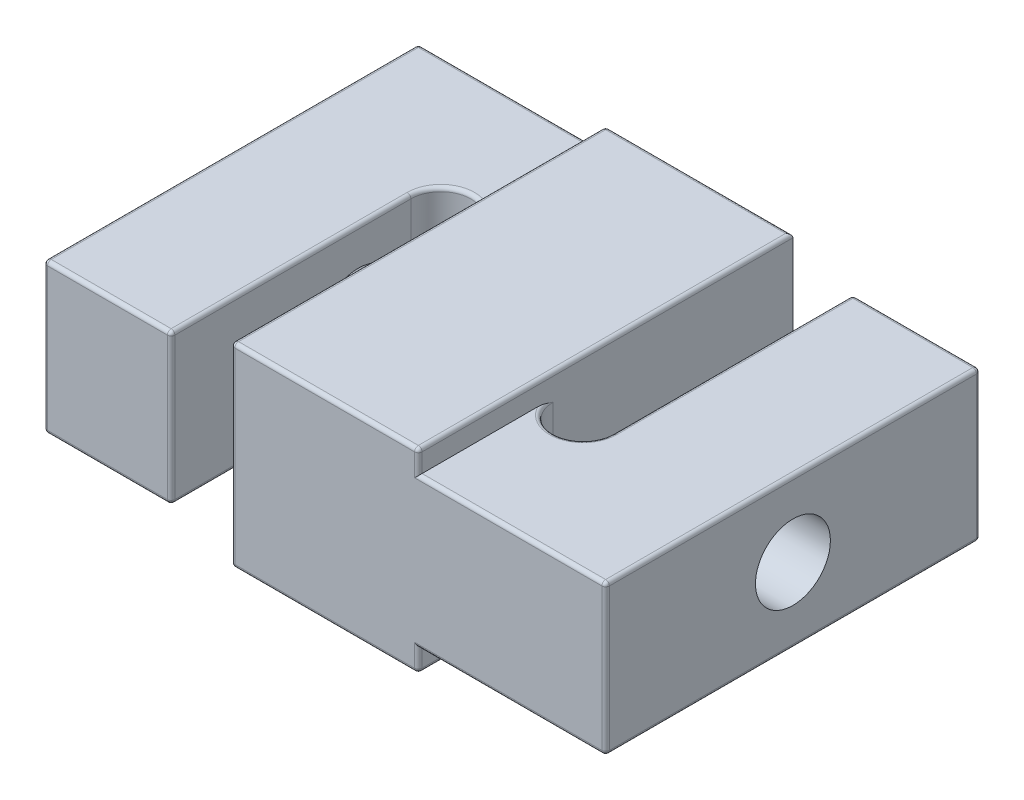
from build123d import *

# Parameters (mm, degrees)
BOSS_EXTRUDE1_DEPTH      = 10
BOSS_EXTRUDE1_DEPTH_BACK = 10
SKETCH1_W                = 75
SKETCH1_H                = 50
SKETCH2_W                = 25
SKETCH2_H                = 50
BOSS_EXTRUDE2_DEPTH      = 3
CUT_EXTRUDE1_DEPTH       = 23
SKETCH5_R                = 5
CUT_EXTRUDE2_DEPTH       = 23
CUT_EXTRUDE3_START       = -23
SKETCH4_R                = 5
CUT_EXTRUDE3_DEPTH       = 23
FILLET1_R                = 0.5


with BuildPart() as part:
    # Sketch1 → Boss-Extrude1 (new, two sides: drawn at the far end of the back side and taken through both)
    with BuildSketch(Plane(origin=(0, 0, 0), x_dir=(1, 0, 0), z_dir=(0, 1, 0)).offset(-BOSS_EXTRUDE1_DEPTH_BACK)):
        Rectangle(SKETCH1_W, SKETCH1_H)
    extrude(amount=BOSS_EXTRUDE1_DEPTH + BOSS_EXTRUDE1_DEPTH_BACK)

    # Sketch2 → Boss-Extrude2 (add)
    with BuildSketch(Plane(origin=(0, 10, 0), x_dir=(1, 0, 0), z_dir=(0, 1, 0))):
        Rectangle(SKETCH2_W, SKETCH2_H)
    boss_extrude2 = extrude(amount=BOSS_EXTRUDE2_DEPTH)

    # Mirror1: Boss-Extrude2 across plane
    add(boss_extrude2.mirror(Plane.ZX))

    # Sketch3 → Cut-Extrude1 (cut)
    with BuildSketch(Plane(origin=(0, 10, 0), x_dir=(1, 0, 0), z_dir=(0, 1, 0))):
        with BuildLine():
            Line((20.5, -7), (20.5, 25))
            Line((20.5, 25), (12.5, 25))
            Line((12.5, 25), (12.5, -7))
            ThreePointArc((12.5, -7), (16.5, -11), (20.5, -7))
        make_face()
        with BuildLine():
            Line((-20.5, 7), (-20.5, -25))
            Line((-20.5, -25), (-12.5, -25))
            Line((-12.5, -25), (-12.5, 7))
            ThreePointArc((-12.5, 7), (-16.5, 11), (-20.5, 7))
        make_face()
    extrude(amount=-CUT_EXTRUDE1_DEPTH, mode=Mode.SUBTRACT)

    # Sketch5 → Cut-Extrude2 (cut)
    with BuildSketch(Plane.ZY.offset(37.5)):
        Circle(SKETCH5_R)
    extrude(amount=-CUT_EXTRUDE2_DEPTH, mode=Mode.SUBTRACT)

    # Sketch4 → Cut-Extrude3 (cut)
    with BuildSketch(Plane(origin=(37.5, 0, 0), x_dir=(0, 0, -1), z_dir=(1, 0, 0)).offset(CUT_EXTRUDE3_START)):
        with Locations(Location((0, 0, 0), (0, 0, 180))):
            Circle(SKETCH4_R)
    extrude(amount=CUT_EXTRUDE3_DEPTH, mode=Mode.SUBTRACT)

    # Fillet1
    # the kernel refuses this fillet: 0.5 mm, written as the material it takes off along each edge
    with BuildSketch(Plane(origin=(37, -9.5, 24.5), x_dir=(0, -1, 0), z_dir=(1, 0, 0))) as fillet1_piece_1_section:
        Polygon((0, 0), (FILLET1_R, 0), (FILLET1_R, -FILLET1_R), (0, -FILLET1_R), align=None)
    fillet1_piece_1 = extrude(amount=FILLET1_R, mode=Mode.PRIVATE)
    fillet1_piece_1 = fillet1_piece_1 - Plane(origin=(37, -9.5, 24.5), x_dir=(0, 0.7071067811865475, -0.7071067811865475), z_dir=(1, 0, 0)) * Sphere(FILLET1_R, mode=Mode.PRIVATE)
    add(fillet1_piece_1, mode=Mode.SUBTRACT)
    with BuildSketch(Plane(origin=(37, 9.5, 24.5), x_dir=(0, 1, 0), z_dir=(1, 0, 0))) as fillet1_piece_2_section:
        Polygon((0, 0), (FILLET1_R, 0), (FILLET1_R, FILLET1_R), (0, FILLET1_R), align=None)
    fillet1_piece_2 = extrude(amount=FILLET1_R, mode=Mode.PRIVATE)
    fillet1_piece_2 = fillet1_piece_2 - Plane(origin=(37, 9.5, 24.5), x_dir=(0, -0.7071067811865475, -0.7071067811865475), z_dir=(1, 0, 0)) * Sphere(FILLET1_R, mode=Mode.PRIVATE)
    add(fillet1_piece_2, mode=Mode.SUBTRACT)
    with BuildSketch(Plane(origin=(37, 9.5, -24.5), x_dir=(1, 0, 0), z_dir=(0, 0, -1))) as fillet1_piece_3_section:
        Polygon((0, 0), (FILLET1_R, 0), (FILLET1_R, -FILLET1_R), (0, -FILLET1_R), align=None)
    fillet1_piece_3 = extrude(amount=FILLET1_R, mode=Mode.PRIVATE)
    fillet1_piece_3 = fillet1_piece_3 - Plane(origin=(37, 9.5, -24.5), x_dir=(-0.7071067811865475, -0.7071067811865475, 0), z_dir=(0, 0, -1)) * Sphere(FILLET1_R, mode=Mode.PRIVATE)
    add(fillet1_piece_3, mode=Mode.SUBTRACT)
    with BuildSketch(Plane(origin=(21, 9.5, -24.5), x_dir=(-1, 0, 0), z_dir=(0, 0, -1))) as fillet1_piece_4_section:
        Polygon((0, 0), (FILLET1_R, 0), (FILLET1_R, FILLET1_R), (0, FILLET1_R), align=None)
    fillet1_piece_4 = extrude(amount=FILLET1_R, mode=Mode.PRIVATE)
    fillet1_piece_4 = fillet1_piece_4 - Plane(origin=(21, 9.5, -24.5), x_dir=(0.7071067811865475, -0.7071067811865475, 0), z_dir=(0, 0, -1)) * Sphere(FILLET1_R, mode=Mode.PRIVATE)
    add(fillet1_piece_4, mode=Mode.SUBTRACT)
    with BuildSketch(Plane(origin=(-37, 9.5, -24.5), x_dir=(0, 0, -1), z_dir=(-1, 0, 0))) as fillet1_piece_5_section:
        Polygon((0, 0), (FILLET1_R, 0), (FILLET1_R, -FILLET1_R), (0, -FILLET1_R), align=None)
    fillet1_piece_5 = extrude(amount=FILLET1_R, mode=Mode.PRIVATE)
    fillet1_piece_5 = fillet1_piece_5 - Plane(origin=(-37, 9.5, -24.5), x_dir=(0, -0.7071067811865475, 0.7071067811865475), z_dir=(-1, 0, 0)) * Sphere(FILLET1_R, mode=Mode.PRIVATE)
    add(fillet1_piece_5, mode=Mode.SUBTRACT)
    with BuildSketch(Plane(origin=(-37, 9.5, 24.5), x_dir=(0, 0, 1), z_dir=(-1, 0, 0))) as fillet1_piece_6_section:
        Polygon((0, 0), (FILLET1_R, 0), (FILLET1_R, FILLET1_R), (0, FILLET1_R), align=None)
    fillet1_piece_6 = extrude(amount=FILLET1_R, mode=Mode.PRIVATE)
    fillet1_piece_6 = fillet1_piece_6 - Plane(origin=(-37, 9.5, 24.5), x_dir=(0, -0.7071067811865475, -0.7071067811865475), z_dir=(-1, 0, 0)) * Sphere(FILLET1_R, mode=Mode.PRIVATE)
    add(fillet1_piece_6, mode=Mode.SUBTRACT)
    with BuildSketch(Plane(origin=(37, -9.5, -24.5), x_dir=(1, 0, 0), z_dir=(0, 0, -1))) as fillet1_piece_7_section:
        Polygon((0, 0), (FILLET1_R, 0), (FILLET1_R, FILLET1_R), (0, FILLET1_R), align=None)
    fillet1_piece_7 = extrude(amount=FILLET1_R, mode=Mode.PRIVATE)
    fillet1_piece_7 = fillet1_piece_7 - Plane(origin=(37, -9.5, -24.5), x_dir=(-0.7071067811865475, 0.7071067811865475, 0), z_dir=(0, 0, -1)) * Sphere(FILLET1_R, mode=Mode.PRIVATE)
    add(fillet1_piece_7, mode=Mode.SUBTRACT)
    with BuildSketch(Plane(origin=(12, 12.5, 24.5), x_dir=(0, 0, 1), z_dir=(0, 1, 0))) as fillet1_piece_8_section:
        Polygon((0, 0), (FILLET1_R, 0), (FILLET1_R, FILLET1_R), (0, FILLET1_R), align=None)
    fillet1_piece_8 = extrude(amount=FILLET1_R, mode=Mode.PRIVATE)
    fillet1_piece_8 = fillet1_piece_8 - Plane(origin=(12, 12.5, 24.5), x_dir=(-0.7071067811865477, 0, -0.7071067811865475), z_dir=(0, 1, 0)) * Sphere(FILLET1_R, mode=Mode.PRIVATE)
    add(fillet1_piece_8, mode=Mode.SUBTRACT)
    with BuildSketch(Plane(origin=(-12, 12.5, -24.5), x_dir=(0, 1, 0), z_dir=(-1, 0, 0))) as fillet1_piece_9_section:
        Polygon((0, 0), (FILLET1_R, 0), (FILLET1_R, FILLET1_R), (0, FILLET1_R), align=None)
    fillet1_piece_9 = extrude(amount=FILLET1_R, mode=Mode.PRIVATE)
    fillet1_piece_9 = fillet1_piece_9 - Plane(origin=(-12, 12.5, -24.5), x_dir=(0, -0.7071067811865475, 0.7071067811865475), z_dir=(-1, 0, 0)) * Sphere(FILLET1_R, mode=Mode.PRIVATE)
    add(fillet1_piece_9, mode=Mode.SUBTRACT)
    with BuildSketch(Plane(origin=(-12, 12.5, 24.5), x_dir=(0, 1, 0), z_dir=(-1, 0, 0))) as fillet1_piece_10_section:
        Polygon((0, 0), (FILLET1_R, 0), (FILLET1_R, -FILLET1_R), (0, -FILLET1_R), align=None)
    fillet1_piece_10 = extrude(amount=FILLET1_R, mode=Mode.PRIVATE)
    fillet1_piece_10 = fillet1_piece_10 - Plane(origin=(-12, 12.5, 24.5), x_dir=(0, -0.7071067811865475, -0.7071067811865475), z_dir=(-1, 0, 0)) * Sphere(FILLET1_R, mode=Mode.PRIVATE)
    add(fillet1_piece_10, mode=Mode.SUBTRACT)
    with BuildSketch(Plane(origin=(-12, -12.5, 24.5), x_dir=(-1, 0, 0), z_dir=(0, -1, 0))) as fillet1_piece_11_section:
        Polygon((0, 0), (FILLET1_R, 0), (FILLET1_R, -FILLET1_R), (0, -FILLET1_R), align=None)
    fillet1_piece_11 = extrude(amount=FILLET1_R, mode=Mode.PRIVATE)
    fillet1_piece_11 = fillet1_piece_11 - Plane(origin=(-12, -12.5, 24.5), x_dir=(0.7071067811865474, 0, -0.7071067811865477), z_dir=(0, -1, 0)) * Sphere(FILLET1_R, mode=Mode.PRIVATE)
    add(fillet1_piece_11, mode=Mode.SUBTRACT)
    with BuildSketch(Plane(origin=(-37, -9.5, -24.5), x_dir=(0, 0, -1), z_dir=(-1, 0, 0))) as fillet1_piece_12_section:
        Polygon((0, 0), (FILLET1_R, 0), (FILLET1_R, FILLET1_R), (0, FILLET1_R), align=None)
    fillet1_piece_12 = extrude(amount=FILLET1_R, mode=Mode.PRIVATE)
    fillet1_piece_12 = fillet1_piece_12 - Plane(origin=(-37, -9.5, -24.5), x_dir=(0, 0.7071067811865475, 0.7071067811865475), z_dir=(-1, 0, 0)) * Sphere(FILLET1_R, mode=Mode.PRIVATE)
    add(fillet1_piece_12, mode=Mode.SUBTRACT)
    with BuildSketch(Plane(origin=(12, -12.5, 24.5), x_dir=(0, 0, 1), z_dir=(0, -1, 0))) as fillet1_piece_13_section:
        Polygon((0, 0), (FILLET1_R, 0), (FILLET1_R, -FILLET1_R), (0, -FILLET1_R), align=None)
    fillet1_piece_13 = extrude(amount=FILLET1_R, mode=Mode.PRIVATE)
    fillet1_piece_13 = fillet1_piece_13 - Plane(origin=(12, -12.5, 24.5), x_dir=(-0.7071067811865477, 0, -0.7071067811865475), z_dir=(0, -1, 0)) * Sphere(FILLET1_R, mode=Mode.PRIVATE)
    add(fillet1_piece_13, mode=Mode.SUBTRACT)
    with BuildSketch(Plane(origin=(-12, -12.5, -24.5), x_dir=(-1, 0, 0), z_dir=(0, -1, 0))) as fillet1_piece_14_section:
        Polygon((0, 0), (FILLET1_R, 0), (FILLET1_R, FILLET1_R), (0, FILLET1_R), align=None)
    fillet1_piece_14 = extrude(amount=FILLET1_R, mode=Mode.PRIVATE)
    fillet1_piece_14 = fillet1_piece_14 - Plane(origin=(-12, -12.5, -24.5), x_dir=(0.7071067811865476, 0, 0.7071067811865475), z_dir=(0, -1, 0)) * Sphere(FILLET1_R, mode=Mode.PRIVATE)
    add(fillet1_piece_14, mode=Mode.SUBTRACT)
    with BuildSketch(Plane(origin=(21, -9.5, -24.5), x_dir=(0, -1, 0), z_dir=(0, 0, -1))) as fillet1_piece_15_section:
        Polygon((0, 0), (FILLET1_R, 0), (FILLET1_R, FILLET1_R), (0, FILLET1_R), align=None)
    fillet1_piece_15 = extrude(amount=FILLET1_R, mode=Mode.PRIVATE)
    fillet1_piece_15 = fillet1_piece_15 - Plane(origin=(21, -9.5, -24.5), x_dir=(0.7071067811865475, 0.7071067811865475, 0), z_dir=(0, 0, -1)) * Sphere(FILLET1_R, mode=Mode.PRIVATE)
    add(fillet1_piece_15, mode=Mode.SUBTRACT)
    with BuildSketch(Plane(origin=(-21, 9.5, 24.5), x_dir=(0, 0, 1), z_dir=(1, 0, 0))) as fillet1_piece_16_section:
        Polygon((0, 0), (FILLET1_R, 0), (FILLET1_R, -FILLET1_R), (0, -FILLET1_R), align=None)
    fillet1_piece_16 = extrude(amount=FILLET1_R, mode=Mode.PRIVATE)
    fillet1_piece_16 = fillet1_piece_16 - Plane(origin=(-21, 9.5, 24.5), x_dir=(0, -0.7071067811865475, -0.7071067811865475), z_dir=(1, 0, 0)) * Sphere(FILLET1_R, mode=Mode.PRIVATE)
    add(fillet1_piece_16, mode=Mode.SUBTRACT)
    with BuildSketch(Plane(origin=(-37, -9.5, 24.5), x_dir=(0, 0, 1), z_dir=(-1, 0, 0))) as fillet1_piece_17_section:
        Polygon((0, 0), (FILLET1_R, 0), (FILLET1_R, -FILLET1_R), (0, -FILLET1_R), align=None)
    fillet1_piece_17 = extrude(amount=FILLET1_R, mode=Mode.PRIVATE)
    fillet1_piece_17 = fillet1_piece_17 - Plane(origin=(-37, -9.5, 24.5), x_dir=(0, 0.7071067811865475, -0.7071067811865475), z_dir=(-1, 0, 0)) * Sphere(FILLET1_R, mode=Mode.PRIVATE)
    add(fillet1_piece_17, mode=Mode.SUBTRACT)
    with BuildSketch(Plane(origin=(-21, -9.5, 24.5), x_dir=(0, 0, 1), z_dir=(1, 0, 0))) as fillet1_piece_18_section:
        Polygon((0, 0), (FILLET1_R, 0), (FILLET1_R, FILLET1_R), (0, FILLET1_R), align=None)
    fillet1_piece_18 = extrude(amount=FILLET1_R, mode=Mode.PRIVATE)
    fillet1_piece_18 = fillet1_piece_18 - Plane(origin=(-21, -9.5, 24.5), x_dir=(0, 0.7071067811865475, -0.7071067811865475), z_dir=(1, 0, 0)) * Sphere(FILLET1_R, mode=Mode.PRIVATE)
    add(fillet1_piece_18, mode=Mode.SUBTRACT)
    with BuildSketch(Plane(origin=(12.5, -10, 25), x_dir=(0, 0, -1), z_dir=(1, 0, 0)), Plane(origin=(-12.5, 10, -25), x_dir=(0, -1, 0), z_dir=(-1, 0, 0))) as fillet1_piece_19:
        with BuildLine():
            CenterArc((FILLET1_R, FILLET1_R), FILLET1_R, 180, 90)
            Line((0, FILLET1_R), (0, 0))
            Line((0, 0), (FILLET1_R, 0))
        make_face()
    extrude(amount=24.5, mode=Mode.SUBTRACT)
    with BuildSketch(Plane(origin=(12.5, 10, 25), x_dir=(0, 0, -1), z_dir=(1, 0, 0)), Plane(origin=(-12.5, -10, -25), x_dir=(0, 1, 0), z_dir=(-1, 0, 0))) as fillet1_piece_20:
        with BuildLine():
            CenterArc((FILLET1_R, -FILLET1_R), FILLET1_R, 90, 90)
            Line((0, -FILLET1_R), (0, 0))
            Line((0, 0), (FILLET1_R, 0))
        make_face()
    extrude(amount=24.5, mode=Mode.SUBTRACT)
    with BuildSketch(Plane(origin=(37.5, 10, 24.5), x_dir=(0, -1, 0), z_dir=(0, 0, -1)), Plane(origin=(-12.5, 13, -24.5), x_dir=(0, -1, 0), z_dir=(0, 0, 1)), Plane(origin=(-12.5, -13, -24.5), x_dir=(1, 0, 0), z_dir=(0, 0, 1)), Plane(origin=(-37.5, -10, -24.5), x_dir=(1, 0, 0), z_dir=(0, 0, 1))) as fillet1_piece_21:
        with BuildLine():
            CenterArc((FILLET1_R, FILLET1_R), FILLET1_R, 180, 90)
            Line((0, FILLET1_R), (0, 0))
            Line((0, 0), (FILLET1_R, 0))
        make_face()
    extrude(amount=49, mode=Mode.SUBTRACT)
    with BuildSketch(Plane(origin=(37, 10, -25), x_dir=(0, -1, 0), z_dir=(-1, 0, 0)), Plane(origin=(-37, -10, 25), x_dir=(0, 0, -1), z_dir=(1, 0, 0))) as fillet1_piece_22:
        with BuildLine():
            CenterArc((FILLET1_R, FILLET1_R), FILLET1_R, 180, 90)
            Line((0, FILLET1_R), (0, 0))
            Line((0, 0), (FILLET1_R, 0))
        make_face()
    extrude(amount=16, mode=Mode.SUBTRACT)
    with BuildSketch(Plane(origin=(-37.5, 10, -24.5), x_dir=(1, 0, 0), z_dir=(0, 0, 1)), Plane(origin=(37.5, -10, 24.5), x_dir=(0, 1, 0), z_dir=(0, 0, -1))) as fillet1_piece_23:
        with BuildLine():
            CenterArc((FILLET1_R, -FILLET1_R), FILLET1_R, 90, 90)
            Line((0, -FILLET1_R), (0, 0))
            Line((0, 0), (FILLET1_R, 0))
        make_face()
    extrude(amount=49, mode=Mode.SUBTRACT)
    with BuildSketch(Plane(origin=(12.5, 10, 25), x_dir=(-1, 0, 0), z_dir=(0, 1, 0)), Plane(origin=(-12.5, -10, -25), x_dir=(0, 0, 1), z_dir=(0, -1, 0))) as fillet1_piece_24:
        with BuildLine():
            CenterArc((FILLET1_R, -FILLET1_R), FILLET1_R, 90, 90)
            Line((0, -FILLET1_R), (0, 0))
            Line((0, 0), (FILLET1_R, 0))
        make_face()
    extrude(amount=2.5, mode=Mode.SUBTRACT)
    with BuildSketch(Plane(origin=(-12.5, 10, -25), x_dir=(0, 0, 1), z_dir=(0, 1, 0)), Plane(origin=(12.5, -10, 25), x_dir=(-1, 0, 0), z_dir=(0, -1, 0))) as fillet1_piece_25:
        with BuildLine():
            CenterArc((FILLET1_R, FILLET1_R), FILLET1_R, 180, 90)
            Line((0, FILLET1_R), (0, 0))
            Line((0, 0), (FILLET1_R, 0))
        make_face()
    extrude(amount=2.5, mode=Mode.SUBTRACT)
    with BuildSketch(Plane(origin=(-12.5, 12.5, 25), x_dir=(1, 0, 0), z_dir=(0, -1, 0))) as fillet1_piece_26:
        with BuildLine():
            CenterArc((FILLET1_R, -FILLET1_R), FILLET1_R, 90, 90)
            Line((0, -FILLET1_R), (0, 0))
            Line((0, 0), (FILLET1_R, 0))
        make_face()
    extrude(amount=25, mode=Mode.SUBTRACT)
    with BuildSketch(Plane(origin=(12.5, 13, 24.5), x_dir=(0, -1, 0), z_dir=(0, 0, -1))) as fillet1_piece_27:
        with BuildLine():
            CenterArc((FILLET1_R, FILLET1_R), FILLET1_R, 180, 90)
            Line((0, FILLET1_R), (0, 0))
            Line((0, 0), (FILLET1_R, 0))
        make_face()
    extrude(amount=50.75, mode=Mode.SUBTRACT)
    with BuildSketch(Plane(origin=(13.75, 13, -25), x_dir=(0, 0, 1), z_dir=(-1, 0, 0))) as fillet1_piece_28:
        with BuildLine():
            CenterArc((FILLET1_R, -FILLET1_R), FILLET1_R, 90, 90)
            Line((0, -FILLET1_R), (0, 0))
            Line((0, 0), (FILLET1_R, 0))
        make_face()
    extrude(amount=25.75, mode=Mode.SUBTRACT)
    with BuildSketch(Plane(origin=(-12, 13, 25), x_dir=(0, -1, 0), z_dir=(1, 0, 0))) as fillet1_piece_29:
        with BuildLine():
            CenterArc((FILLET1_R, FILLET1_R), FILLET1_R, 180, 90)
            Line((0, FILLET1_R), (0, 0))
            Line((0, 0), (FILLET1_R, 0))
        make_face()
    extrude(amount=24, mode=Mode.SUBTRACT)
    with BuildSketch(Plane(origin=(12.5, -13, 24.5), x_dir=(0, 1, 0), z_dir=(0, 0, -1))) as fillet1_piece_30:
        with BuildLine():
            CenterArc((FILLET1_R, -FILLET1_R), FILLET1_R, 90, 90)
            Line((0, -FILLET1_R), (0, 0))
            Line((0, 0), (FILLET1_R, 0))
        make_face()
    extrude(amount=50.75, mode=Mode.SUBTRACT)
    with BuildSketch(Plane(origin=(-12, -13, 25), x_dir=(0, 1, 0), z_dir=(1, 0, 0))) as fillet1_piece_31:
        with BuildLine():
            CenterArc((FILLET1_R, -FILLET1_R), FILLET1_R, 90, 90)
            Line((0, -FILLET1_R), (0, 0))
            Line((0, 0), (FILLET1_R, 0))
        make_face()
    extrude(amount=24, mode=Mode.SUBTRACT)
    with BuildSketch(Plane(origin=(13.75, -13, -25), x_dir=(0, 0, 1), z_dir=(-1, 0, 0))) as fillet1_piece_32:
        with BuildLine():
            CenterArc((FILLET1_R, FILLET1_R), FILLET1_R, 180, 90)
            Line((0, FILLET1_R), (0, 0))
            Line((0, 0), (FILLET1_R, 0))
        make_face()
    extrude(amount=25.75, mode=Mode.SUBTRACT)
    with BuildSketch(Plane(origin=(37, -10, -25), x_dir=(0, 1, 0), z_dir=(-1, 0, 0)), Plane(origin=(-37, 10, 25), x_dir=(0, 0, -1), z_dir=(1, 0, 0))) as fillet1_piece_33:
        with BuildLine():
            CenterArc((FILLET1_R, -FILLET1_R), FILLET1_R, 90, 90)
            Line((0, -FILLET1_R), (0, 0))
            Line((0, 0), (FILLET1_R, 0))
        make_face()
    extrude(amount=16, mode=Mode.SUBTRACT)
    with BuildSketch(Plane(origin=(20.5, -10, 7), x_dir=(1, 0, 0), z_dir=(0, 0, -1)), Plane(origin=(20.5, 10, 7), x_dir=(0, -1, 0), z_dir=(0, 0, -1)), Plane(origin=(-20.5, -10, -7), x_dir=(-1, 0, 0), z_dir=(0, 0, 1))) as fillet1_piece_34:
        with BuildLine():
            CenterArc((FILLET1_R, -FILLET1_R), FILLET1_R, 90, 90)
            Line((0, -FILLET1_R), (0, 0))
            Line((0, 0), (FILLET1_R, 0))
        make_face()
    extrude(amount=31.5, mode=Mode.SUBTRACT)
    with BuildSketch(Plane(origin=(20.5, 9.5, -25), x_dir=(1, 0, 0), z_dir=(0, -1, 0))) as fillet1_piece_35:
        with BuildLine():
            CenterArc((FILLET1_R, FILLET1_R), FILLET1_R, 180, 90)
            Line((0, FILLET1_R), (0, 0))
            Line((0, 0), (FILLET1_R, 0))
        make_face()
    extrude(amount=19, mode=Mode.SUBTRACT)
    with BuildSketch(Plane(origin=(16.5, -10, 7), x_dir=(-0.9514133218682644, 0, -0.3079166948568956), z_dir=(0.3079166948568956, 0, -0.9514133218682644))) as fillet1_piece_36_section:
        with BuildLine():
            CenterArc((4 + FILLET1_R, FILLET1_R), FILLET1_R, 180, 90)
            Line((4, FILLET1_R), (4, 0))
            Line((4, 0), (4 + FILLET1_R, 0))
        make_face()
    fillet1_piece_36 = revolve(axis=Axis((16.5, -10, 7), (0, 1, 0)), revolution_arc=197.933725613, mode=Mode.PRIVATE)
    fillet1_piece_36 = split(fillet1_piece_36, bisect_by=Plane(origin=(12.5, -9.730182657, 5.956665677), z_dir=(1, 0, 0)), keep=Keep.TOP, mode=Mode.PRIVATE)
    add(fillet1_piece_36, mode=Mode.SUBTRACT)
    with BuildSketch(Plane(origin=(16.5, 10, 7), x_dir=(-0.9514133218682644, 0, -0.3079166948568956), z_dir=(0.3079166948568956, 0, -0.9514133218682644))) as fillet1_piece_37_section:
        with BuildLine():
            CenterArc((4 + FILLET1_R, -FILLET1_R), FILLET1_R, 90, 90)
            Line((4, -FILLET1_R), (4, 0))
            Line((4, 0), (4 + FILLET1_R, 0))
        make_face()
    fillet1_piece_37 = revolve(axis=Axis((16.5, 10, 7), (0, 1, 0)), revolution_arc=197.933725613, mode=Mode.PRIVATE)
    fillet1_piece_37 = split(fillet1_piece_37, bisect_by=Plane(origin=(12.5, 9.730182657, 5.956665677), z_dir=(1, 0, 0)), keep=Keep.TOP, mode=Mode.PRIVATE)
    add(fillet1_piece_37, mode=Mode.SUBTRACT)
    with BuildSketch(Plane(origin=(-20.5, 9.5, 25), x_dir=(0, 0, -1), z_dir=(0, -1, 0)), Plane(origin=(37.5, 9.5, -25), x_dir=(-1, 0, 0), z_dir=(0, -1, 0)), Plane(origin=(37.5, 9.5, 25), x_dir=(0, 0, -1), z_dir=(0, -1, 0)), Plane(origin=(-37.5, -9.5, 25), x_dir=(0, 0, -1), z_dir=(0, 1, 0)), Plane(origin=(-37.5, -9.5, -25), x_dir=(1, 0, 0), z_dir=(0, 1, 0))) as fillet1_piece_38:
        with BuildLine():
            CenterArc((FILLET1_R, -FILLET1_R), FILLET1_R, 90, 90)
            Line((0, -FILLET1_R), (0, 0))
            Line((0, 0), (FILLET1_R, 0))
        make_face()
    extrude(amount=19, mode=Mode.SUBTRACT)
    with BuildSketch(Plane(origin=(-16.5, -10, -7), x_dir=(0.9514133218682642, 0, 0.30791669485689566), z_dir=(-0.30791669485689566, 0, 0.9514133218682642))) as fillet1_piece_39_section:
        with BuildLine():
            CenterArc((4 + FILLET1_R, FILLET1_R), FILLET1_R, 180, 90)
            Line((4 + FILLET1_R, 0), (4, 0))
            Line((4, 0), (4, FILLET1_R))
        make_face()
    fillet1_piece_39 = revolve(axis=Axis((-16.5, -10, -7), (0, 1, 0)), revolution_arc=197.933725613, mode=Mode.PRIVATE)
    fillet1_piece_39 = split(fillet1_piece_39, bisect_by=Plane(origin=(-12.5, -9.579289162, -5.96924255), z_dir=(-1, 0, 0)), keep=Keep.TOP, mode=Mode.PRIVATE)
    add(fillet1_piece_39, mode=Mode.SUBTRACT)
    with BuildSketch(Plane(origin=(-16.5, 10, -7), x_dir=(0.9514133218682642, 0, 0.30791669485689566), z_dir=(-0.30791669485689566, 0, 0.9514133218682642))) as fillet1_piece_40_section:
        with BuildLine():
            CenterArc((4 + FILLET1_R, -FILLET1_R), FILLET1_R, 90, 90)
            Line((4 + FILLET1_R, 0), (4, 0))
            Line((4, 0), (4, -FILLET1_R))
        make_face()
    fillet1_piece_40 = revolve(axis=Axis((-16.5, 10, -7), (0, 1, 0)), revolution_arc=197.933725613, mode=Mode.PRIVATE)
    fillet1_piece_40 = split(fillet1_piece_40, bisect_by=Plane(origin=(-12.5, 9.579289162, -5.96924255), z_dir=(-1, 0, 0)), keep=Keep.TOP, mode=Mode.PRIVATE)
    add(fillet1_piece_40, mode=Mode.SUBTRACT)
    with BuildSketch(Plane(origin=(-20.5, 10, -7), x_dir=(-1, 0, 0), z_dir=(0, 0, 1))) as fillet1_piece_41:
        with BuildLine():
            CenterArc((FILLET1_R, FILLET1_R), FILLET1_R, 180, 90)
            Line((0, FILLET1_R), (0, 0))
            Line((0, 0), (FILLET1_R, 0))
        make_face()
    extrude(amount=31.5, mode=Mode.SUBTRACT)
    with BuildSketch(Plane(origin=(11.25, -10, 25), x_dir=(0, 0, -1), z_dir=(1, 0, 0))) as fillet1_piece_42a_section:
        with BuildLine():
            CenterArc((FILLET1_R, FILLET1_R), FILLET1_R, 180, 90)
            Line((0, FILLET1_R), (0, 0))
            Line((0, 0), (FILLET1_R, 0))
        make_face()
    fillet1_piece_42a = extrude(amount=25.75, mode=Mode.PRIVATE)
    fillet1_piece_42a = split(fillet1_piece_42a, bisect_by=Plane(origin=(12.5, -9.886802443, 24.886802443), z_dir=(-1, 0, 0)), keep=Keep.TOP, mode=Mode.PRIVATE)
    with BuildSketch(Plane(origin=(12.5, -8.75, 25), x_dir=(-1, 0, 0), z_dir=(0, -1, 0))) as fillet1_piece_42b_section:
        with BuildLine():
            CenterArc((FILLET1_R, FILLET1_R), FILLET1_R, 180, 90)
            Line((0, FILLET1_R), (0, 0))
            Line((0, 0), (FILLET1_R, 0))
        make_face()
    fillet1_piece_42b = extrude(amount=3.75, mode=Mode.PRIVATE)
    fillet1_piece_42b = split(fillet1_piece_42b, bisect_by=Plane(origin=(12.386802443, -10, 24.886802443), z_dir=(0, 1, 0)), keep=Keep.TOP, mode=Mode.PRIVATE)
    fillet1_piece_42 = fillet1_piece_42a & fillet1_piece_42b
    add(fillet1_piece_42, mode=Mode.SUBTRACT)
    with BuildSketch(Plane(origin=(11.25, 10, 25), x_dir=(0, 0, -1), z_dir=(1, 0, 0))) as fillet1_piece_43a_section:
        with BuildLine():
            CenterArc((FILLET1_R, -FILLET1_R), FILLET1_R, 90, 90)
            Line((0, -FILLET1_R), (0, 0))
            Line((0, 0), (FILLET1_R, 0))
        make_face()
    fillet1_piece_43a = extrude(amount=25.75, mode=Mode.PRIVATE)
    fillet1_piece_43a = split(fillet1_piece_43a, bisect_by=Plane(origin=(12.5, 9.886802443, 24.886802443), z_dir=(-1, 0, 0)), keep=Keep.TOP, mode=Mode.PRIVATE)
    with BuildSketch(Plane(origin=(12.5, 8.75, 25), x_dir=(-1, 0, 0), z_dir=(0, 1, 0))) as fillet1_piece_43b_section:
        with BuildLine():
            CenterArc((FILLET1_R, -FILLET1_R), FILLET1_R, 90, 90)
            Line((0, -FILLET1_R), (0, 0))
            Line((0, 0), (FILLET1_R, 0))
        make_face()
    fillet1_piece_43b = extrude(amount=3.75, mode=Mode.PRIVATE)
    fillet1_piece_43b = split(fillet1_piece_43b, bisect_by=Plane(origin=(12.386802443, 10, 24.886802443), z_dir=(0, -1, 0)), keep=Keep.TOP, mode=Mode.PRIVATE)
    fillet1_piece_43 = fillet1_piece_43a & fillet1_piece_43b
    add(fillet1_piece_43, mode=Mode.SUBTRACT)
    with BuildSketch(Plane(origin=(-12.5, 8.75, -25), x_dir=(0, 0, 1), z_dir=(0, 1, 0))) as fillet1_piece_44a_section:
        with BuildLine():
            CenterArc((FILLET1_R, FILLET1_R), FILLET1_R, 180, 90)
            Line((0, FILLET1_R), (0, 0))
            Line((0, 0), (FILLET1_R, 0))
        make_face()
    fillet1_piece_44a = extrude(amount=3.75, mode=Mode.PRIVATE)
    fillet1_piece_44a = split(fillet1_piece_44a, bisect_by=Plane(origin=(-12.386802443, 10, -24.886802443), z_dir=(0, -1, 0)), keep=Keep.TOP, mode=Mode.PRIVATE)
    with BuildSketch(Plane(origin=(-11.25, 10, -25), x_dir=(0, -1, 0), z_dir=(-1, 0, 0))) as fillet1_piece_44b_section:
        with BuildLine():
            CenterArc((FILLET1_R, FILLET1_R), FILLET1_R, 180, 90)
            Line((0, FILLET1_R), (0, 0))
            Line((0, 0), (FILLET1_R, 0))
        make_face()
    fillet1_piece_44b = extrude(amount=25.75, mode=Mode.PRIVATE)
    fillet1_piece_44b = split(fillet1_piece_44b, bisect_by=Plane(origin=(-12.5, 9.886802443, -24.886802443), z_dir=(1, 0, 0)), keep=Keep.TOP, mode=Mode.PRIVATE)
    fillet1_piece_44 = fillet1_piece_44a & fillet1_piece_44b
    add(fillet1_piece_44, mode=Mode.SUBTRACT)
    with BuildSketch(Plane(origin=(-12.5, -8.75, -25), x_dir=(0, 0, 1), z_dir=(0, -1, 0))) as fillet1_piece_45a_section:
        with BuildLine():
            CenterArc((FILLET1_R, -FILLET1_R), FILLET1_R, 90, 90)
            Line((0, -FILLET1_R), (0, 0))
            Line((0, 0), (FILLET1_R, 0))
        make_face()
    fillet1_piece_45a = extrude(amount=3.75, mode=Mode.PRIVATE)
    fillet1_piece_45a = split(fillet1_piece_45a, bisect_by=Plane(origin=(-12.386802443, -10, -24.886802443), z_dir=(0, 1, 0)), keep=Keep.TOP, mode=Mode.PRIVATE)
    with BuildSketch(Plane(origin=(-11.25, -10, -25), x_dir=(0, 1, 0), z_dir=(-1, 0, 0))) as fillet1_piece_45b_section:
        with BuildLine():
            CenterArc((FILLET1_R, -FILLET1_R), FILLET1_R, 90, 90)
            Line((0, -FILLET1_R), (0, 0))
            Line((0, 0), (FILLET1_R, 0))
        make_face()
    fillet1_piece_45b = extrude(amount=25.75, mode=Mode.PRIVATE)
    fillet1_piece_45b = split(fillet1_piece_45b, bisect_by=Plane(origin=(-12.5, -9.886802443, -24.886802443), z_dir=(1, 0, 0)), keep=Keep.TOP, mode=Mode.PRIVATE)
    fillet1_piece_45 = fillet1_piece_45a & fillet1_piece_45b
    add(fillet1_piece_45, mode=Mode.SUBTRACT)


solid = part.part
